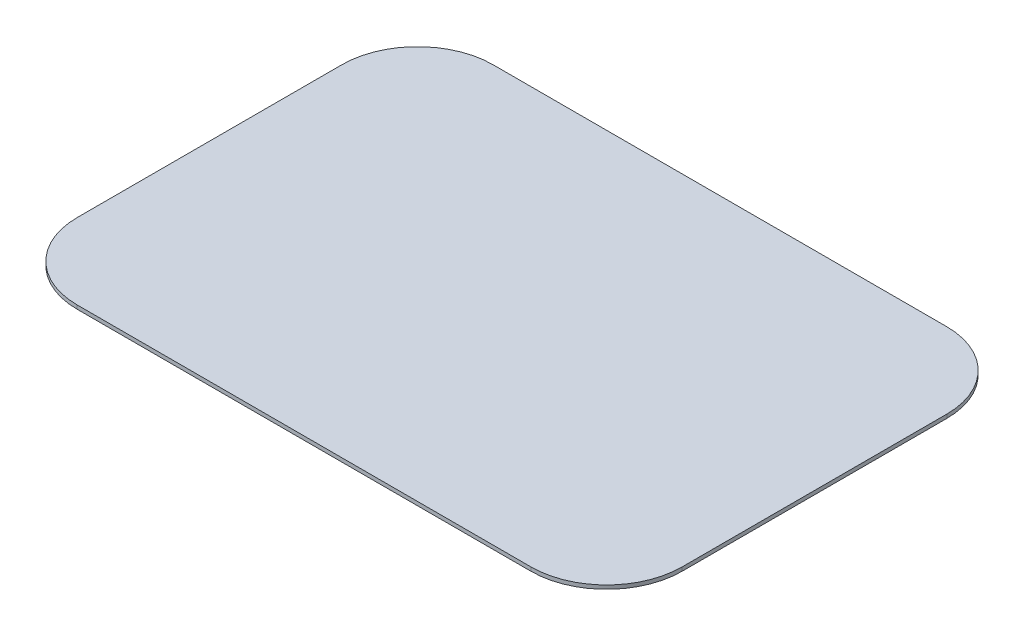
from build123d import *

# Parameters (mm, degrees)
SKETCH1_W           = 160
SKETCH1_H           = 110
BOSS_EXTRUDE1_DEPTH = 1
FILLET1_R           = 20


with BuildPart() as part:
    # Sketch1 → Boss-Extrude1 (new body)
    with BuildSketch(Plane(origin=(0, 0, 0), x_dir=(1, 0, 0), z_dir=(0, 1, 0))):
        Rectangle(SKETCH1_W, SKETCH1_H)
    extrude(amount=-BOSS_EXTRUDE1_DEPTH)

    # Fillet1
    fillet1_edges = [part.edges().sort_by_distance(p)[0] for p in [
        (80, -0.5, -55),
        (80, -0.5, 55),
        (-80, -0.5, 55),
        (-80, -0.5, -55),
    ]]
    fillet(fillet1_edges, radius=FILLET1_R)


solid = part.part
